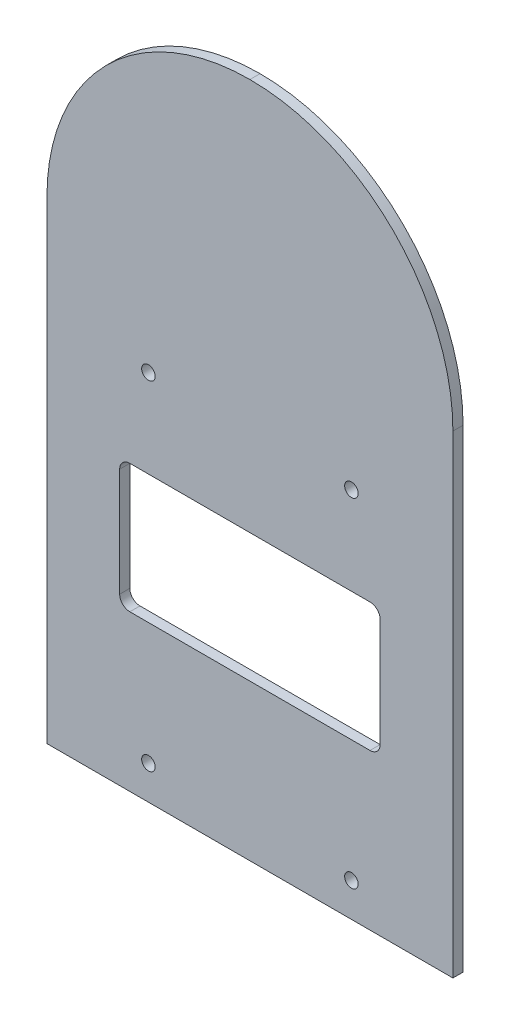
from build123d import *

# Parameters (mm, degrees)
SKETCH1_W           = 120
SKETCH1_H           = 200
BOSS_EXTRUDE1_DEPTH = 3
FILLET1_R           = 60
CUT_EXTRUDE1_DEPTH  = 3
SKETCH3_R           = 2
CUT_EXTRUDE2_DEPTH  = 10


with BuildPart() as part:
    # Sketch1 → Boss-Extrude1 (new body)
    with BuildSketch(Plane.XY):
        Rectangle(SKETCH1_W, SKETCH1_H)
    extrude(amount=BOSS_EXTRUDE1_DEPTH)

    # Fillet1
    fillet1_edges = [part.edges().sort_by_distance(p)[0] for p in [
        (60, 100, 1.5),
        (-60, 100, 1.5),
    ]]
    fillet(fillet1_edges, radius=FILLET1_R - 0.0001)  # a hair under: the kernel refuses the full size

    # Sketch2 → Cut-Extrude1 (cut)
    with BuildSketch(Plane.XY.offset(3)):
        with BuildLine():
            Line((-35.5, -16), (35.5, -16))
            ThreePointArc((35.5, -16), (37.621320344, -16.878679656), (38.5, -19))
            Line((38.5, -19), (38.5, -51))
            ThreePointArc((38.5, -51), (37.621320344, -53.121320344), (35.5, -54))
            Line((35.5, -54), (-35.5, -54))
            ThreePointArc((-35.5, -54), (-37.621320344, -53.121320344), (-38.5, -51))
            Line((-38.5, -51), (-38.5, -19))
            ThreePointArc((-38.5, -19), (-37.621320344, -16.878679656), (-35.5, -16))
        make_face()
    extrude(amount=-CUT_EXTRUDE1_DEPTH, mode=Mode.SUBTRACT)

    # Sketch3 → Cut-Extrude2 (cut)
    with BuildSketch(Plane.XY.offset(3)):
        with Locations((-30, -90)):
            Circle(SKETCH3_R)
        with Locations((-30, 10)):
            Circle(SKETCH3_R)
        with Locations((30, 10)):
            Circle(SKETCH3_R)
        with Locations((30, -90)):
            Circle(SKETCH3_R)
    extrude(amount=-CUT_EXTRUDE2_DEPTH, mode=Mode.SUBTRACT)


solid = part.part
